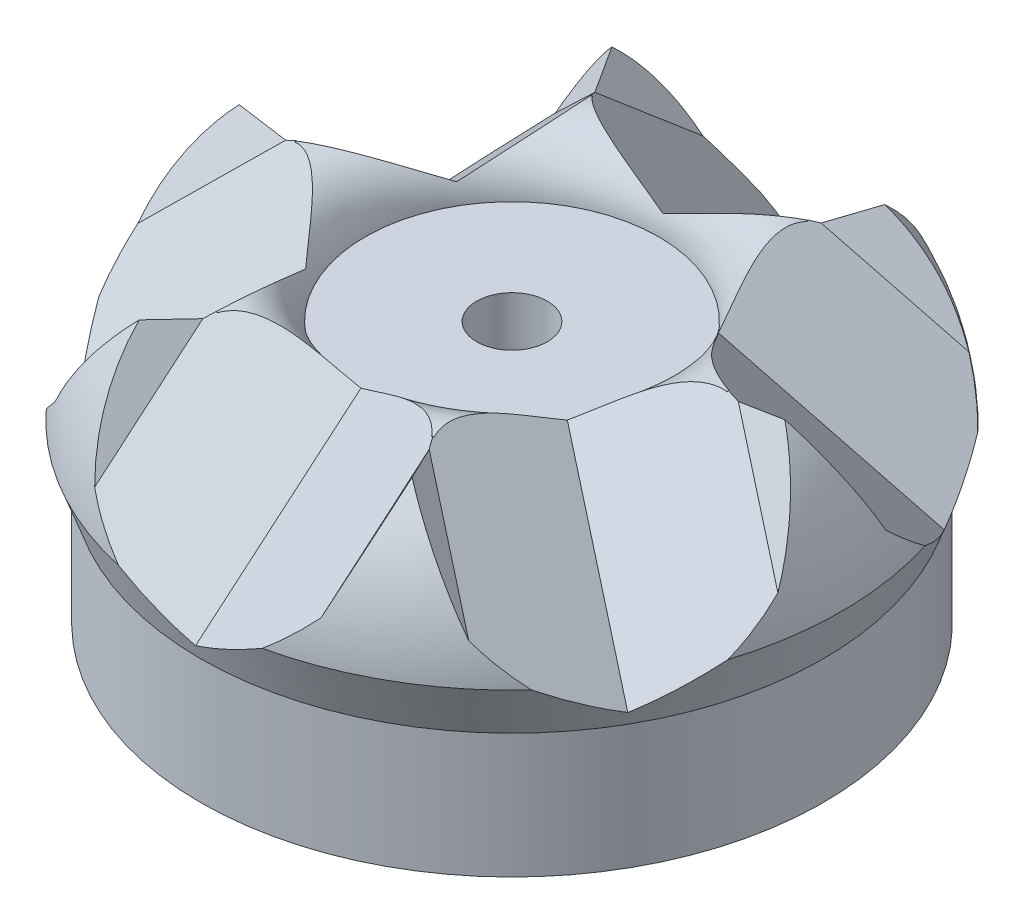
from build123d import *

# Parameters (mm, degrees)
CUT_EXTRUDE2_DEPTH      = 10
CUT_EXTRUDE2_DEPTH_BACK = 26.691866016
SKETCH11_R              = 1.7
SKETCH13_R              = 5
CUT_EXTRUDE3_DEPTH      = 25.582587175
CIRPATTERN1_COUNT       = 6
BOSS_EXTRUDE1_START     = -6
SKETCH16_R              = 15
SKETCH16_R_2            = 1.7
BOSS_EXTRUDE1_DEPTH     = 6


with BuildPart() as part:
    # Sketch1 → Revolve1 (revolve)
    with BuildSketch(Plane.XY):
        with BuildLine():
            Line((0, 0), (-15, 0))
            Line((-15, 0), (-15.879288175, 2.415824406))
            ThreePointArc((-15.879288175, 2.415824406), (-10.375944202, 11.214556131), (0, 11.004183227))
            Line((0, 11.004183227), (0, 0))
        make_face()
    revolve(axis=Axis((0, 11.004183227, 0), (0, -1, 0)))

    # Sketch11 → Cut-Extrude2 (cut, two sides: drawn at the far end of the back side and taken through both)
    with BuildSketch(Plane(origin=(0, 0, 0), x_dir=(1, 0, 0), z_dir=(0, 1, 0)).offset(-CUT_EXTRUDE2_DEPTH_BACK)):
        Circle(SKETCH11_R)
    extrude(amount=CUT_EXTRUDE2_DEPTH + CUT_EXTRUDE2_DEPTH_BACK, mode=Mode.SUBTRACT)

    # Sketch13 → Cut-Extrude3 (cut, through all)
    with BuildSketch(Plane.XZ.offset(-10)):
        Circle(SKETCH13_R)
    extrude(amount=-CUT_EXTRUDE3_DEPTH, mode=Mode.SUBTRACT)

    # Cut-Sweep2: sweep along a path in Sketch14
    with BuildLine(Plane(origin=(0, 0, 0), x_dir=(0, 0, -1), z_dir=(1, 0, 0))) as cut_sweep2_path:
        Line((-17.620563201, 7.19993822), (0, 22.158438756))
    # Sketch4 → Cut-Sweep2 (sweep, cut)
    with BuildSketch(Plane(origin=(0, -4.820907073, 13.245333323), x_dir=(1, 0, 0), z_dir=(0, -0.3420201433256676, 0.9396926207859088))):
        Polygon((0, 5.84272581), (-5.451245942, 8.355540871), (-7.725385353, 11.666420308), (-9.044567695, 12.335821133), (-6.573600429, 15.724420925), (0, 17.674830406), (6.573600429, 15.724420925), (9.044567695, 12.335821133), (7.725385353, 11.666420308), (5.451245942, 8.355540871), align=None)
    cut_sweep2 = sweep(path=cut_sweep2_path.line, mode=Mode.SUBTRACT)

    # CirPattern1: Cut-Sweep2 ×6 about axis
    cirpattern1_axis = Axis((0, 2.415824406, 0), (0, -1, 0))
    for i in range(1, CIRPATTERN1_COUNT):
        add(cut_sweep2.rotate(cirpattern1_axis, i * 360 / CIRPATTERN1_COUNT), mode=Mode.SUBTRACT)

    # Sketch15 → Cut-Revolve1 (revolve, cut)
    with BuildSketch(Plane(origin=(0, 0, 0), x_dir=(0, 0, -1), z_dir=(1, 0, 0))):
        with BuildLine():
            Line((-7.066678284, 6.573301744), (0, 6.573301744))
            Line((0, 6.573301744), (0, 13.825819792))
            Line((0, 13.825819792), (-10.414235534, 13.825819792))
            Line((-10.414235534, 13.825819792), (-10.414235534, 8.865518575))
            ThreePointArc((-10.414235534, 8.865518575), (-8.188336968, 8.525727034), (-7.066678284, 6.573301744))
        make_face()
    revolve(axis=Axis((0, 6.573301744, 0), (0, 1, 0)), mode=Mode.SUBTRACT)

    # Sketch16 → Boss-Extrude1 (add)
    with BuildSketch(Plane(origin=(0, 0, 0), x_dir=(1, 0, 0), z_dir=(0, 1, 0)).offset(BOSS_EXTRUDE1_START)):
        Circle(SKETCH16_R)
        Circle(SKETCH16_R_2, mode=Mode.SUBTRACT)
    extrude(amount=BOSS_EXTRUDE1_DEPTH)


solid = part.part
